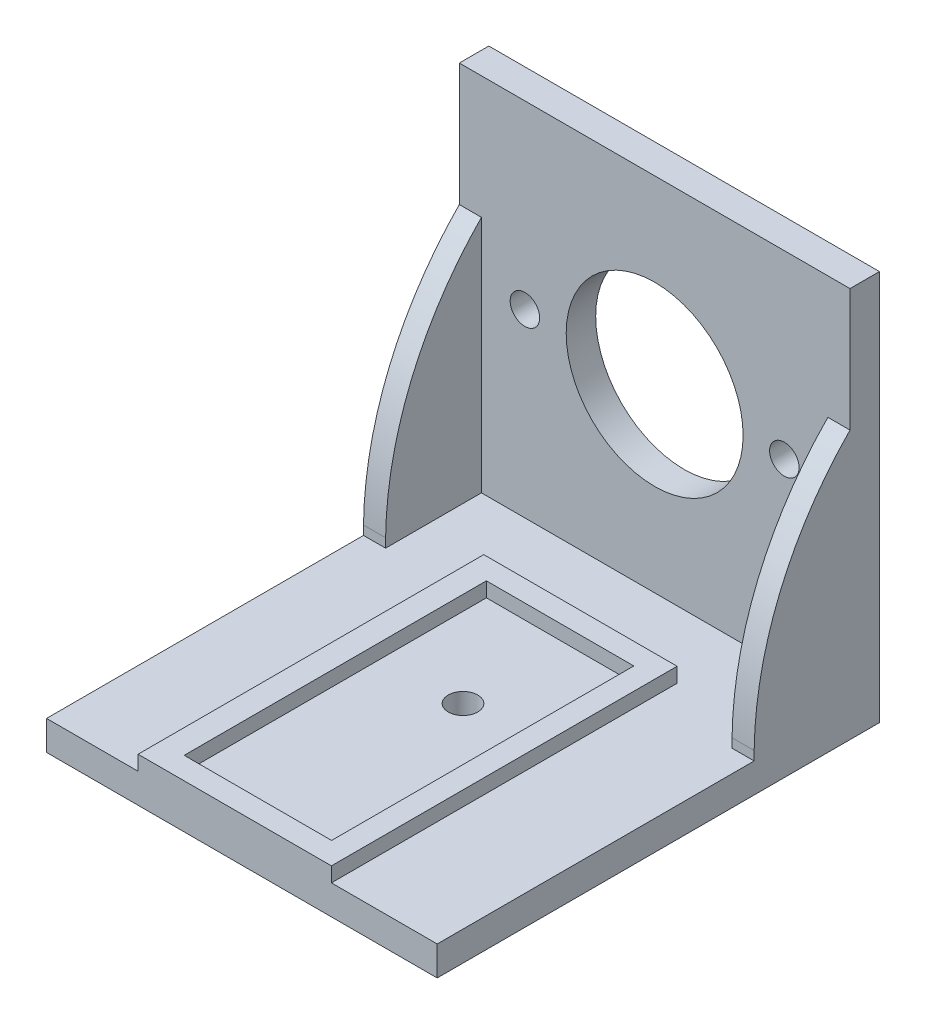
from build123d import *

# Parameters (mm, degrees)
ESBO_O1_W                  = 53
ESBO_O1_H                  = 53
RESSALTO_EXTRUS_O1_DEPTH   = 4
ESBO_O2_W                  = 53
ESBO_O2_H                  = 4
RESSALTO_EXTRUS_O2_DEPTH   = 60
CORTE_EXTRUS_O1_DEPTH      = 21
CORTE_EXTRUS_O1_DEPTH_BACK = 18
ESBO_O3_R                  = 12
CORTE_EXTRUS_O2_DEPTH      = 17
CORTE_EXTRUS_O2_DEPTH_BACK = 15
ESBO_O4_R                  = 2
ESBO_O5_W                  = 3
ESBO_O5_H                  = 36.373853852
RESSALTO_EXTRUS_O3_DEPTH   = 17
CORTE_EXTRUS_O3_DEPTH      = 62
CORTE_EXTRUS_O3_DEPTH_BACK = 15
ESBO_O7_W                  = 26.228570329
ESBO_O7_H                  = 46.898944641
ESBO_O7_W_2                = 20
ESBO_O7_H_2                = 41
RESSALTO_EXTRUS_O4_DEPTH   = 6
CORTE_EXTRUS_O4_DEPTH      = 10
CORTE_EXTRUS_O4_DEPTH_BACK = 21
ESBO_O8_R                  = 2


with BuildPart() as part:
    # Esboço1 → Ressalto-extrusão1 (new body)
    with BuildSketch(Plane.XY):
        with Locations((26.5, 26.5)):
            Rectangle(ESBO_O1_W, ESBO_O1_H)
    extrude(amount=RESSALTO_EXTRUS_O1_DEPTH)

    # Esboço2 → Ressalto-extrusão2 (add)
    with BuildSketch(Plane.XY):
        with Locations((26.5, 2)):
            Rectangle(ESBO_O2_W, ESBO_O2_H)
    extrude(amount=RESSALTO_EXTRUS_O2_DEPTH)

    # Esboço3 → Corte-extrusão1 (cut, two sides: drawn at the far end of the back side and taken through both)
    with BuildSketch(Plane.XY.offset(-CORTE_EXTRUS_O1_DEPTH_BACK)):
        with Locations((26.5, 28.5)):
            Circle(ESBO_O3_R)
    extrude(amount=CORTE_EXTRUS_O1_DEPTH + CORTE_EXTRUS_O1_DEPTH_BACK, mode=Mode.SUBTRACT)

    # Esboço4 → Corte-extrusão2 (cut, two sides: drawn at the far end of the back side and taken through both)
    with BuildSketch(Plane.XY.offset(-CORTE_EXTRUS_O2_DEPTH_BACK)):
        with Locations((8.9, 28.5)):
            Circle(ESBO_O4_R)
        with Locations((44.1, 28.5)):
            Circle(ESBO_O4_R)
    extrude(amount=CORTE_EXTRUS_O2_DEPTH + CORTE_EXTRUS_O2_DEPTH_BACK, mode=Mode.SUBTRACT)

    # Esboço5 → Ressalto-extrusão3 (add)
    with BuildSketch(Plane.XY):
        with Locations((1.5, 18.186926926)):
            Rectangle(ESBO_O5_W, ESBO_O5_H)
        with Locations((51.5, 18.186926926)):
            Rectangle(ESBO_O5_W, ESBO_O5_H)
    extrude(amount=RESSALTO_EXTRUS_O3_DEPTH)

    # Esboço6 → Corte-extrusão3 (cut, two sides: drawn at the far end of the back side and taken through both)
    with BuildSketch(Plane(origin=(0, 0, 0), x_dir=(0, 0, -1), z_dir=(1, 0, 0)).offset(-CORTE_EXTRUS_O3_DEPTH_BACK)):
        with BuildLine():
            ThreePointArc((-17, 5.226597996), (-13.510052949, 22.056538471), (-4, 36.373853852))
            Line((-4, 36.373853852), (-17, 36.373853852))
            Line((-17, 36.373853852), (-17, 5.226597996))
        make_face()
    extrude(amount=CORTE_EXTRUS_O3_DEPTH + CORTE_EXTRUS_O3_DEPTH_BACK, mode=Mode.SUBTRACT)

    # Esboço7 → Ressalto-extrusão4 (add)
    with BuildSketch(Plane(origin=(0, 0, 0), x_dir=(1, 0, 0), z_dir=(0, 1, 0))):
        with Locations((25.531831297, -36.55052768)):
            Rectangle(ESBO_O7_W, ESBO_O7_H)
        with Locations((25.674113589, -36.5)):
            Rectangle(ESBO_O7_W_2, ESBO_O7_H_2, mode=Mode.SUBTRACT)
    extrude(amount=RESSALTO_EXTRUS_O4_DEPTH)

    # Esboço8 → Corte-extrusão4 (cut, two sides: drawn at the far end of the back side and taken through both)
    with BuildSketch(Plane(origin=(0, 0, 0), x_dir=(1, 0, 0), z_dir=(0, 1, 0)).offset(-CORTE_EXTRUS_O4_DEPTH_BACK)):
        with Locations((26.5, -30)):
            Circle(ESBO_O8_R)
    extrude(amount=CORTE_EXTRUS_O4_DEPTH + CORTE_EXTRUS_O4_DEPTH_BACK, mode=Mode.SUBTRACT)


solid = part.part
